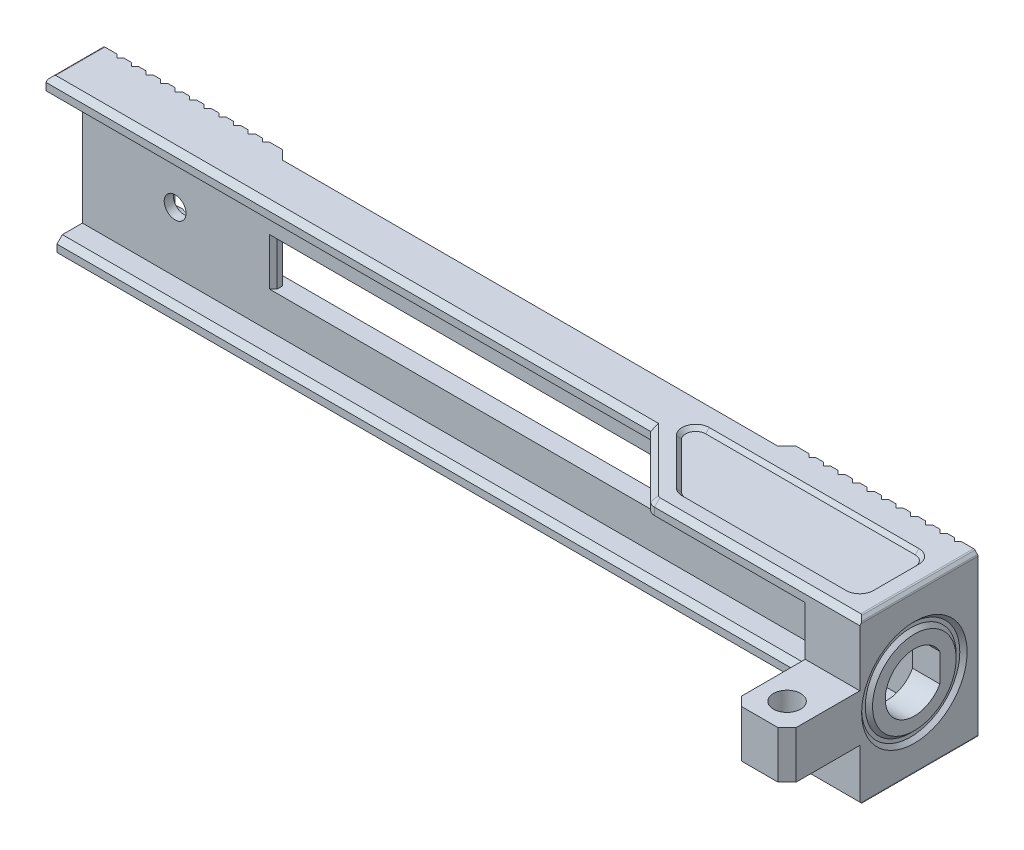
from build123d import *
from OCP.BRepFilletAPI import BRepFilletAPI_MakeChamfer

# Parameters (mm, degrees)
EXTRUDE_1_DEPTH      = 18
SKETCH_2_W           = 11
SKETCH_2_H           = 14
CUT_EXTRUDE_1_DEPTH  = 93.5
CUT_EXTRUDE_2_REACH  = 100.414
SKETCH_4_W           = 1
SKETCH_4_H           = 14
EXTRUDE_2_DEPTH      = 3
SKETCH_5_W           = 8
SKETCH_5_H           = 5.2
EXTRUDE_3_DEPTH      = 6
SKETCH_6_R           = 5.4
SKETCH_6_R_2         = 5
CUT_EXTRUDE_3_DEPTH  = 0.4
CHAMFER_2_SIZE       = 0.4
SKETCH_7_W           = 20
SKETCH_7_H           = 2
CUT_EXTRUDE_4_DEPTH  = 86
SKETCH_8_R           = 1.5
CUT_EXTRUDE_5_DEPTH  = 99.298982701
CHAMFER_3_SIZE       = 1
CUT_EXTRUDE_6_REACH  = 102.386
SKETCH_9_W           = 54.5
SKETCH_9_H           = 5.2
EXTRUDE_4_DEPTH      = 1
CHAMFER_5_SIZE       = 1
CHAMFER_6_SIZE       = 1
CHAMFER_6_SIZE2      = 3.732050808
FILLET_3_R           = 5
SKETCH_13_R          = 2.1
CUT_EXTRUDE_9_DEPTH  = 1
CUT_EXTRUDE_10_REACH = 102.181
SKETCH_14_R          = 1.2
CUT_EXTRUDE_7_DEPTH  = 0.4
FILLET_4_R           = 1
CHAMFER_9_SIZE       = 0.6
CHAMFER_8_SIZE       = 0.4
FILLET_2_R           = 0.2
CUT_EXTRUDE_8_DEPTH  = 100.303826714
SKETCH_15_W          = 6.5
SKETCH_15_H          = 9
CUT_EXTRUDE_11_DEPTH = 0.4
FILLET_1_R           = 1.5
CHAMFER_7_SIZE       = 0.4
CHAMFER_10_SIZE      = 0.4


with BuildPart() as part:
    # 草图1 → 凸台-拉伸1 (new body)
    with BuildSketch(Plane(origin=(0, 0, 0), x_dir=(1, 0, 0), z_dir=(0, 1, 0))):
        Polygon((76.5, 6), (96.5, 6), (96.5, -7), (73.5, -7), (66.5, 0), (0, 0), (0, 6), (20, 6), (21, 5), (75.5, 5), align=None)
    extrude(amount=EXTRUDE_1_DEPTH)

    # 草图2 → 切除-拉伸1 (cut)
    with BuildSketch(Plane.ZY):
        with Locations((1.5, 9)):
            Rectangle(SKETCH_2_W, SKETCH_2_H)
    extrude(amount=-CUT_EXTRUDE_1_DEPTH, mode=Mode.SUBTRACT)

    # 草图3 → 切除-拉伸2 (cut, up to next)
    with BuildSketch(Plane(origin=(96.5, 0, 0), x_dir=(0, 0, -1), z_dir=(1, 0, 0)), mode=Mode.PRIVATE) as cut_extrude_2_sk1:
        with BuildLine():
            Line((1.8, 7.450806662), (1.8, 10.549193338))
            ThreePointArc((1.8, 10.549193338), (-4.2, 9), (1.8, 7.450806662))
        make_face()
    cut_extrude_2_tool1 = extrude(cut_extrude_2_sk1.sketch, amount=-CUT_EXTRUDE_2_REACH, mode=Mode.PRIVATE) & part.part
    add(cut_extrude_2_tool1.solids().sort_by_distance((96.5, 9, 1.079109))[0], mode=Mode.SUBTRACT)

    # 草图4 → 凸台-拉伸2 (add)
    with BuildSketch(Plane.ZY.offset(-93.5)):
        with Locations((6.5, 9)):
            Rectangle(SKETCH_4_W, SKETCH_4_H)
    extrude(amount=EXTRUDE_2_DEPTH)

    # 草图5 → 凸台-拉伸3 (add)
    with BuildSketch(Plane(origin=(96.5, 0, 0), x_dir=(0, 0, -1), z_dir=(1, 0, 0))):
        with Locations((-11, 8.6)):
            Rectangle(SKETCH_5_W, SKETCH_5_H)
    extrude(amount=-EXTRUDE_3_DEPTH)

    # 草图6 → 切除-拉伸3 (cut)
    with BuildSketch(Plane(origin=(96.5, 0, 0), x_dir=(0, 0, -1), z_dir=(1, 0, 0))):
        with Locations((-1, 9)):
            Circle(SKETCH_6_R)
        with Locations((-1, 9)):
            Circle(SKETCH_6_R_2, mode=Mode.SUBTRACT)
    extrude(amount=-CUT_EXTRUDE_3_DEPTH, mode=Mode.SUBTRACT)

    # 倒角2
    chamfer_2_edges = [part.edges().sort_by_distance(p)[0] for p in [
        (96.5, 9, 6.4),
        (96.5, 9, 6),
    ]]
    chamfer(chamfer_2_edges, length=CHAMFER_2_SIZE - 0.0001)  # a hair under: the kernel refuses the full size

    # 草图7 → 切除-拉伸4 (cut)
    with BuildSketch(Plane.ZY):
        with Locations((8.8, 1)):
            Rectangle(SKETCH_7_W, SKETCH_7_H)
    extrude(amount=-CUT_EXTRUDE_4_DEPTH, mode=Mode.SUBTRACT)

    # 草图8 → 切除-拉伸5 (cut, through all)
    with BuildSketch(Plane(origin=(0, 11.2, 0), x_dir=(1, 0, 0), z_dir=(0, 1, 0))):
        with Locations(Location((93.5, -12, 0), (0, 0, 270))):
            Circle(SKETCH_8_R)
    extrude(amount=-CUT_EXTRUDE_5_DEPTH, mode=Mode.SUBTRACT)

    # 倒角3
    chamfer_3_edges = [part.edges().sort_by_distance(p)[0] for p in [
        (90.5, 8.6, 15),
        (96.5, 8.6, 15),
    ]]
    chamfer(chamfer_3_edges, length=CHAMFER_3_SIZE)

    # 草图9 → 切除-拉伸6 (cut, up to next)
    with BuildSketch(Plane(origin=(0, 0, -6), x_dir=(-1, 0, 0), z_dir=(0, 0, -1)), mode=Mode.PRIVATE) as cut_extrude_6_sk1:
        with Locations((-48.25, 8.6)):
            Rectangle(SKETCH_9_W, SKETCH_9_H)
    cut_extrude_6_tool1 = extrude(cut_extrude_6_sk1.sketch, amount=-CUT_EXTRUDE_6_REACH, mode=Mode.PRIVATE) & part.part
    add(cut_extrude_6_tool1.solids().sort_by_distance((48.25, 8.6, -6))[0], mode=Mode.SUBTRACT)

    # 草图10 → 凸台-拉伸4 (add)
    with BuildSketch(Plane(origin=(0, 0, -5), x_dir=(-1, 0, 0), z_dir=(0, 0, -1))):
        Polygon((-76.5, 11.2), (-20, 11.2), (-20, 12.2), (-35, 12.2), (-35, 18), (-36, 18), (-36, 12.2), (-60.5, 12.2), (-60.5, 18), (-61.5, 18), (-61.5, 12.2), (-76.5, 12.2), align=None)
        Polygon((-76.5, 6), (-20, 6), (-20, 5), (-35, 5), (-35, 0), (-36, 0), (-36, 5), (-60.5, 5), (-60.5, 0), (-61.5, 0), (-61.5, 5), (-76.5, 5), align=None)
    extrude(amount=EXTRUDE_4_DEPTH)

    # 倒角5
    chamfer_5_edges = [part.edges().sort_by_distance(p)[0] for p in [
        (68.5, 5, -5),
        (28, 5, -5),
        (48.25, 5, -5),
        (28, 12.2, -5),
        (48.25, 12.2, -5),
        (68.5, 12.2, -5),
    ]]
    chamfer(chamfer_5_edges, length=CHAMFER_5_SIZE - 0.0001)  # a hair under: the kernel refuses the full size

    # 倒角6: one chamfer whose edges measure the first distance from different faces: ONE call of the kernel's chamfer builder (chamfer() names one face for all edges)
    chamfer_6_edges_1 = [part.edges().sort_by_distance(p)[0] for p in [
        (61, 18, -6),
        (35.5, 18, -6),
    ]]
    chamfer_6_side_1 = [part.faces().sort_by_distance(p)[0] for p in [
        (57.361404126, 18, -1.156000938),
    ]]
    chamfer_6_edges_2 = [part.edges().sort_by_distance(p)[0] for p in [
        (35.5, 0, -6),
        (61, 0, -6),
    ]]
    chamfer_6_side_2 = [part.faces().sort_by_distance(p)[0] for p in [
        (55.717325534, 0, -2.26585989),
    ]]
    chamfer_6 = BRepFilletAPI_MakeChamfer(part.part.solid().wrapped)
    for e in chamfer_6_edges_1:
        chamfer_6.Add(CHAMFER_6_SIZE, CHAMFER_6_SIZE2, e.wrapped, chamfer_6_side_1[0].wrapped)  # the first distance lies on this face
    for e in chamfer_6_edges_2:
        chamfer_6.Add(CHAMFER_6_SIZE, CHAMFER_6_SIZE2, e.wrapped, chamfer_6_side_2[0].wrapped)  # the first distance lies on this face
    add(Compound.cast(chamfer_6.Shape()), mode=Mode.REPLACE)

    # 圆角3
    fillet_3_edges = [part.edges().sort_by_distance(p)[0] for p in [
        (61, 3.732050808, -6),
        (35.5, 3.732050808, -6),
        (35.5, 14.267949192, -6),
        (61, 14.267949192, -6),
    ]]
    fillet(fillet_3_edges, radius=FILLET_3_R)

    # 草图13 → 切除-拉伸9 (cut)
    with BuildSketch(Plane(origin=(0, 0, -6), x_dir=(-1, 0, 0), z_dir=(0, 0, -1))):
        with Locations((-10.2, 8.6)):
            Circle(SKETCH_13_R)
    extrude(amount=-CUT_EXTRUDE_9_DEPTH, mode=Mode.SUBTRACT)

    # 草图14 → 切除-拉伸10 (cut, up to next)
    with BuildSketch(Plane(origin=(0, 0, -5), x_dir=(-1, 0, 0), z_dir=(0, 0, -1)), mode=Mode.PRIVATE) as cut_extrude_10_sk1:
        with Locations((-10.2, 8.6)):
            Circle(SKETCH_14_R)
    cut_extrude_10_tool1 = extrude(cut_extrude_10_sk1.sketch, amount=-CUT_EXTRUDE_10_REACH, mode=Mode.PRIVATE) & part.part
    add(cut_extrude_10_tool1.solids().sort_by_distance((10.2, 8.6, -5))[0], mode=Mode.SUBTRACT)

    # 草图11 → 切除-拉伸7 (cut)
    with BuildSketch(Plane(origin=(0, 18, 0), x_dir=(1, 0, 0), z_dir=(0, 1, 0))):
        Polygon((66.328427125, 3), (94.5, 3), (94.5, -5), (74.328427125, -5), align=None)
    extrude(amount=-CUT_EXTRUDE_7_DEPTH, mode=Mode.SUBTRACT)

    # 圆角4
    fillet_4_edges = [part.edges().sort_by_distance(p)[0] for p in [
        (86, 1, 7),
        (73.5, 17, 7),
    ]]
    fillet(fillet_4_edges, radius=FILLET_4_R)

    # 倒角9
    chamfer_9_edges = [part.edges().sort_by_distance(p)[0] for p in [
        (43, 2, -1.2),
        (86, 0, 2.4),
        (43, 0, -1.2),
        (69.853553391, 18, 3.353553391),
        (91.75, 0, 7),
        (86.292893219, 0, 6.707106781),
        (86, 2, 2.4),
        (86.292893219, 2, 6.707106781),
        (85.207106781, 18, 7),
        (73.53153013, 16, 6.923879533),
        (73.53153013, 18, 6.923879533),
        (33.25, 16, 0),
        (69.853553391, 16, 3.353553391),
        (88.75, 2, 7),
        (82.207106781, 16, 7),
        (33.25, 18, 0),
    ]]
    chamfer(chamfer_9_edges, length=CHAMFER_9_SIZE)

    # 倒角8
    chamfer_8_edges = [part.edges().sort_by_distance(p)[0] for p in [
        (0, 0, -3.9),
        (96.5, 0, 0.2),
        (96.5, 18, 0.2),
        (0, 18, -3.3),
    ]]
    chamfer(chamfer_8_edges, length=CHAMFER_8_SIZE)

    # 圆角2
    fillet_2_edges = [part.edges().sort_by_distance(p)[0] for p in [
        (96.5, 17.6, 0.4),
        (96.5, 0.4, 0.4),
        (0.4, 0, -3.9),
        (96.1, 0, 0.2),
        (0.4, 18, -3.3),
        (96.1, 18, 0.2),
        (0, 17.6, -3.1),
        (0, 0.4, -3.7),
    ]]
    fillet(fillet_2_edges, radius=FILLET_2_R)

    # 草图12 → 切除-拉伸8 (cut, through all)
    with BuildSketch(Plane(origin=(0, 18, 0), x_dir=(1, 0, 0), z_dir=(0, 1, 0))):
        Polygon((1.8, 6), (2.6, 6), (2.2, 5.6), align=None)
        Polygon((3.4, 6), (4.2, 6), (3.8, 5.6), align=None)
        Polygon((5, 6), (5.8, 6), (5.4, 5.6), align=None)
        Polygon((6.6, 6), (7.4, 6), (7, 5.6), align=None)
        Polygon((8.2, 6), (9, 6), (8.6, 5.6), align=None)
        Polygon((9.8, 6), (10.6, 6), (10.2, 5.6), align=None)
        Polygon((11.4, 6), (12.2, 6), (11.8, 5.6), align=None)
        Polygon((13, 6), (13.8, 6), (13.4, 5.6), align=None)
        Polygon((14.6, 6), (15.4, 6), (15, 5.6), align=None)
        Polygon((16.2, 6), (17, 6), (16.6, 5.6), align=None)
        Polygon((17.8, 6), (18.6, 6), (18.2, 5.6), align=None)
        Polygon((93.9, 6), (94.7, 6), (94.3, 5.6), align=None)
        Polygon((92.3, 6), (92.7, 5.6), (93.1, 6), align=None)
        Polygon((90.7, 6), (91.1, 5.6), (91.5, 6), align=None)
        Polygon((89.1, 6), (89.5, 5.6), (89.9, 6), align=None)
        Polygon((87.5, 6), (87.9, 5.6), (88.3, 6), align=None)
        Polygon((85.9, 6), (86.3, 5.6), (86.7, 6), align=None)
        Polygon((84.3, 6), (84.7, 5.6), (85.1, 6), align=None)
        Polygon((82.7, 6), (83.1, 5.6), (83.5, 6), align=None)
        Polygon((81.1, 6), (81.5, 5.6), (81.9, 6), align=None)
        Polygon((79.5, 6), (79.9, 5.6), (80.3, 6), align=None)
        Polygon((77.9, 6), (78.3, 5.6), (78.7, 6), align=None)
    extrude(amount=-CUT_EXTRUDE_8_DEPTH, mode=Mode.SUBTRACT)

    # 草图15 → 切除-拉伸11 (cut)
    with BuildSketch(Plane.XZ):
        with Locations((91.25, 0.5)):
            Rectangle(SKETCH_15_W, SKETCH_15_H)
    extrude(amount=-CUT_EXTRUDE_11_DEPTH, mode=Mode.SUBTRACT)

    # 圆角1
    fillet_1_edges = [part.edges().sort_by_distance(p)[0] for p in [
        (74.328427125, 17.8, 5),
        (66.328427125, 17.8, -3),
        (94.5, 17.8, -3),
        (94.5, 17.8, 5),
        (88, 0.2, -4),
        (88, 0.2, 5),
        (94.5, 0.2, 5),
        (94.5, 0.2, -4),
    ]]
    fillet(fillet_1_edges, radius=FILLET_1_R)

    # 倒角7
    chamfer_7_edges = [part.edges().sort_by_distance(p)[0] for p in [
        (83.974873734, 17.6, 5),
        (94.060660172, 17.6, 4.560660172),
        (74.37572232, 17.6, 4.885819299),
        (94.5, 17.6, 1),
        (71.389087297, 17.6, 2.060660172),
        (94.060660172, 17.6, -2.560660172),
        (68.56392817, 17.6, -2.074025149),
        (81.474873734, 17.6, -3),
        (88.439339828, 0.4, -3.560660172),
        (91.25, 0.4, -4),
        (88, 0.4, 0.5),
        (94.060660172, 0.4, -3.560660172),
        (88.439339828, 0.4, 4.560660172),
        (94.5, 0.4, 0.5),
        (91.25, 0.4, 5),
        (94.060660172, 0.4, 4.560660172),
    ]]
    chamfer(chamfer_7_edges, length=CHAMFER_7_SIZE - 0.0001)  # a hair under: the kernel refuses the full size

    # 倒角10
    chamfer_10_edges = [part.edges().sort_by_distance(p)[0] for p in [
        (75.5, 8.6, -4),
        (21, 8.6, -4),
    ]]
    chamfer(chamfer_10_edges, length=CHAMFER_10_SIZE)


solid = part.part
